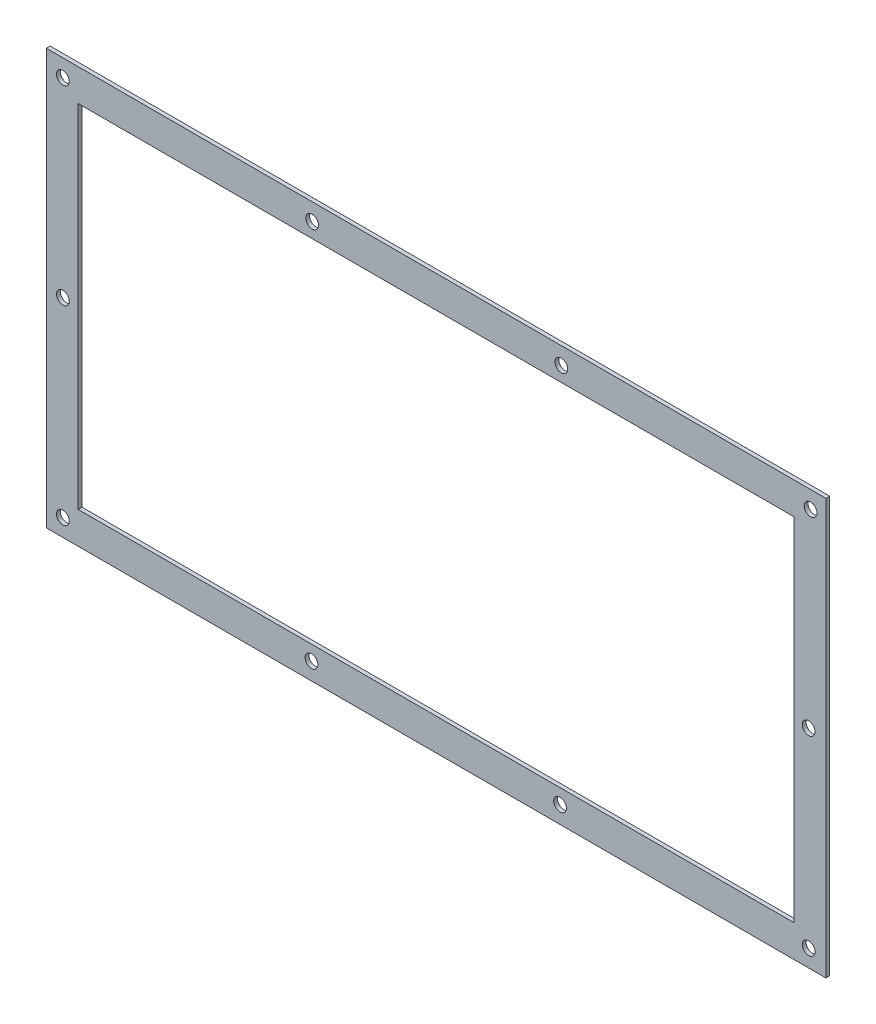
from build123d import *

# Parameters (mm, degrees)
SKETCH1_W           = 610
SKETCH1_H           = 325
SKETCH1_W_2         = 560
SKETCH1_H_2         = 275
BOSS_EXTRUDE1_DEPTH = 3
SKETCH2_R           = 5
CUT_EXTRUDE1_DEPTH  = 4
LPATTERN1_COUNT     = 4
LPATTERN1_PITCH     = 195
LPATTERN2_COUNT     = 3
LPATTERN2_PITCH     = 149
LPATTERN3_OUTLINE_R = 5
LPATTERN3_DEPTH     = 3
LPATTERN4_OUTLINE_R = 5
LPATTERN4_DEPTH     = 3


# Read off the part's stored shape, not the designer's step: LPattern3, LPattern4
with BuildPart() as part:
    # Sketch1 → Boss-Extrude1 (new body)
    with BuildSketch(Plane.XY):
        with Locations((-100, -37.5)):
            Rectangle(SKETCH1_W, SKETCH1_H)
        with Locations((-100, -37.5)):
            Rectangle(SKETCH1_W_2, SKETCH1_H_2, mode=Mode.SUBTRACT)
    extrude(amount=BOSS_EXTRUDE1_DEPTH)

    # Sketch2 → Cut-Extrude1 (cut)
    with BuildSketch(Plane.XY.offset(3)):
        with Locations((-392, 111.5)):
            Circle(SKETCH2_R)
    cut_extrude1 = extrude(amount=-CUT_EXTRUDE1_DEPTH, mode=Mode.SUBTRACT)

    # LPattern1: Cut-Extrude1 ×4
    with Locations(*[(i * LPATTERN1_PITCH, 0, 0) for i in range(1, LPATTERN1_COUNT)]):
        add(cut_extrude1, mode=Mode.SUBTRACT)

    # LPattern2: Cut-Extrude1 ×3
    with Locations(*[(0, -i * LPATTERN2_PITCH, 0) for i in range(1, LPATTERN2_COUNT)]):
        add(cut_extrude1, mode=Mode.SUBTRACT)

    # LPattern3 outline → LPattern3 (cut)
    with BuildSketch(Plane.XY):
        with Locations((191.5, -186.5)):
            Circle(LPATTERN3_OUTLINE_R)
        with Locations((-3, -186.5)):
            Circle(LPATTERN3_OUTLINE_R)
        with Locations((-197.5, -186.5)):
            Circle(LPATTERN3_OUTLINE_R)
    extrude(amount=LPATTERN3_DEPTH, mode=Mode.SUBTRACT)

    # LPattern4 outline → LPattern4 (cut)
    with BuildSketch(Plane.XY):
        with Locations((191.5, -37.5)):
            Circle(LPATTERN4_OUTLINE_R)
    extrude(amount=LPATTERN4_DEPTH, mode=Mode.SUBTRACT)


solid = part.part
